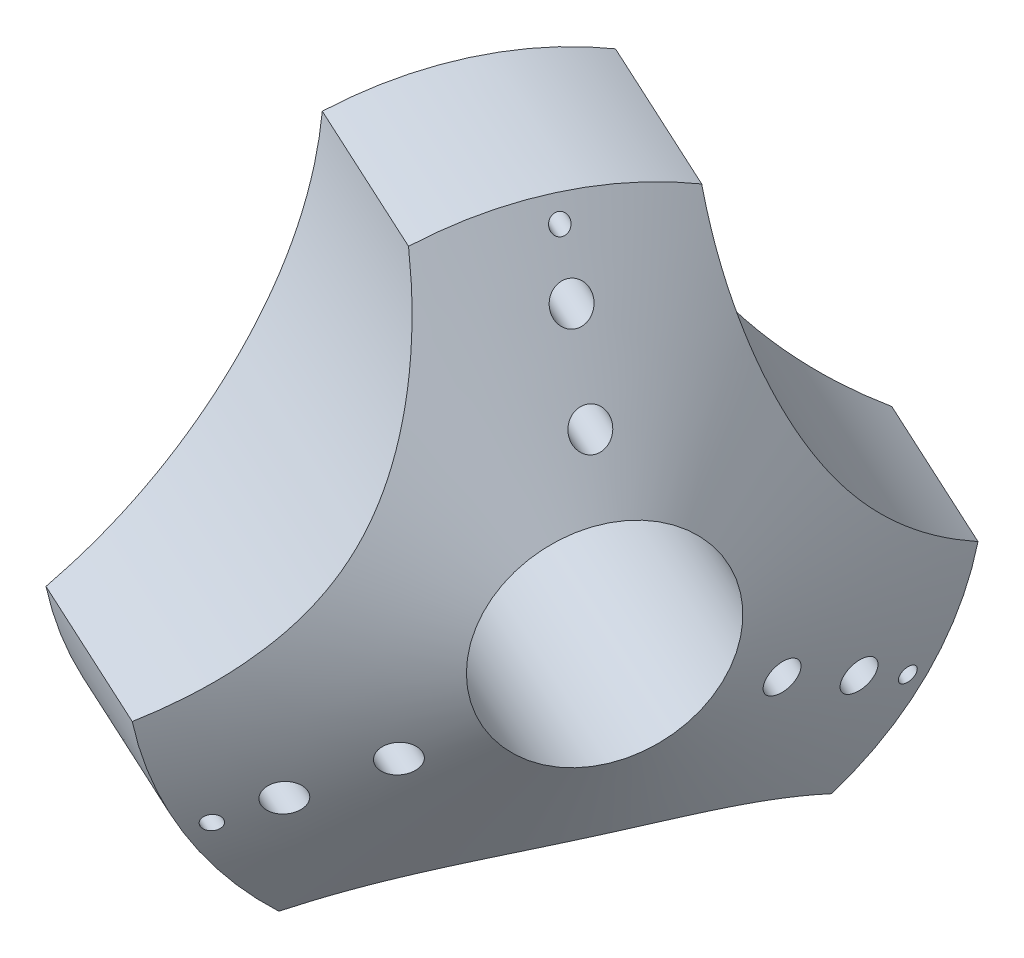
from build123d import *

# Parameters (mm, degrees)
SKETCH_2_R          = 2
SKETCH_2_R_2        = 1
SKETCH_2_R_3        = 54
SKETCH_2_R_4        = 12.5
CUT_EXTRUDE_1_DEPTH = 58
FILLET_1_R          = 3.5
SHELL_1_T           = 2


with BuildPart() as part:
    # 草图1 → 旋转1 (revolve)
    with BuildSketch(Plane(origin=(0, 0, 0), x_dir=(1, 0, 0), z_dir=(0, 1, 0))):
        Polygon((0, -42.145180374), (-19.213449814, -33.278671202), (-33.688160901, -58.349606181), (0, -73.895781724), align=None)
    revolve(axis=Axis((-38.709047482, 0, 67.04603682), (0.9079820101810507, 0, 0.4190091516752092)))

    # 草图2 → 切除-拉伸1 (cut)
    with BuildSketch(Plane(origin=(-5.574305918, 0, -2.572391488), x_dir=(-0.4190091516752093, 0, 0.9079820101810506), z_dir=(-0.9079820101810507, 0, -0.41900915167520936))):
        with Locations((77.096040434, 30)):
            Circle(SKETCH_2_R)
        with Locations((77.096040434, 20)):
            Circle(SKETCH_2_R)
        with Locations((77.096040434, 36.328994352)):
            Circle(SKETCH_2_R_2)
        with Locations((9.8924691, 38.8)):
            Circle(SKETCH_2_R_3)
        with Locations((144.299611768, 38.8)):
            Circle(SKETCH_2_R_3)
        with Locations((108.557872437, -18.164497176)):
            Circle(SKETCH_2_R_2)
        with Locations((103.076802547, -15)):
            Circle(SKETCH_2_R)
        with Locations((94.41654851, -10)):
            Circle(SKETCH_2_R)
        with Locations((77.096040434, -77.6)):
            Circle(SKETCH_2_R_3)
        with Locations((45.634208431, -18.164497176)):
            Circle(SKETCH_2_R_2)
        with Locations((51.11527832, -15)):
            Circle(SKETCH_2_R)
        with Locations((59.775532358, -10)):
            Circle(SKETCH_2_R)
        with Locations((77.096040434, 0)):
            Circle(SKETCH_2_R_4)
    extrude(amount=-CUT_EXTRUDE_1_DEPTH, mode=Mode.SUBTRACT)

    # 圆角1
    fillet_1_edges = [part.edges().sort_by_distance(p)[0] for p in [
        (-37.670553652, 12.5, 67.525273648),
    ]]
    fillet(fillet_1_edges, radius=FILLET_1_R)

    # 抽壳1 (no face opened: a closed hollow body)
    add(offset(amount=-SHELL_1_T, mode=Mode.PRIVATE), mode=Mode.SUBTRACT)


solid = part.part
